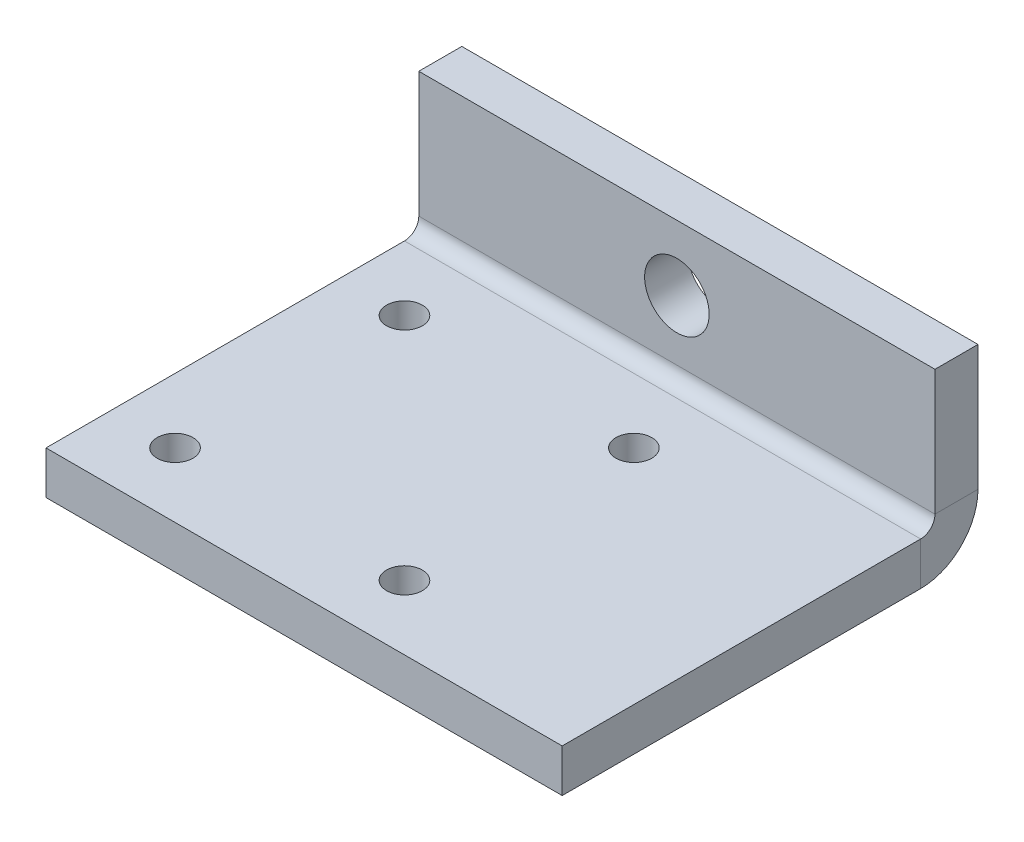
from build123d import *

# Parameters (mm, degrees)
T_LE_DE_BASE_PLI_E1_DEPTH = 36
TROU_TARAUD_M31_D         = 2.5
D_GAGEMENT_M41_D          = 4.5


# Sheet-metal steps are written as plain solids
with BuildPart() as part:
    # Tôle de base pliée1: sheet metal written as solids
    # Esquisse1 → Tôle de base pliée1 (new body)
    with BuildSketch(Plane(origin=(0, 0, 0), x_dir=(0, 0, -1), z_dir=(1, 0, 0))):
        with BuildLine():
            Line((0, 12.75), (0, 4))
            ThreePointArc((0, 4), (-1.171572875, 1.171572875), (-4, 0))
            Line((-4, 0), (-29, 0))
            Line((-29, 0), (-29, 3))
            Line((-29, 3), (-4, 3))
            ThreePointArc((-4, 3), (-3.292893219, 3.292893219), (-3, 4))
            Line((-3, 4), (-3, 12.75))
            Line((-3, 12.75), (0, 12.75))
        make_face()
    extrude(amount=T_LE_DE_BASE_PLI_E1_DEPTH)

    # Trou taraudé M31 (through all)
    with Locations(Plane(origin=(0, 3, 0), x_dir=(1, 0, 0), z_dir=(0, 1, 0))):
        with Locations((4.5, -24.5), (4.5, -8.5), (20.5, -8.5), (20.5, -24.5)):
            Hole(TROU_TARAUD_M31_D / 2)

    # Dégagement M41 (through all)
    with Locations(Plane.XY.offset(3)):
        with Locations((18, 8.2)):
            Hole(D_GAGEMENT_M41_D / 2)


solid = part.part
